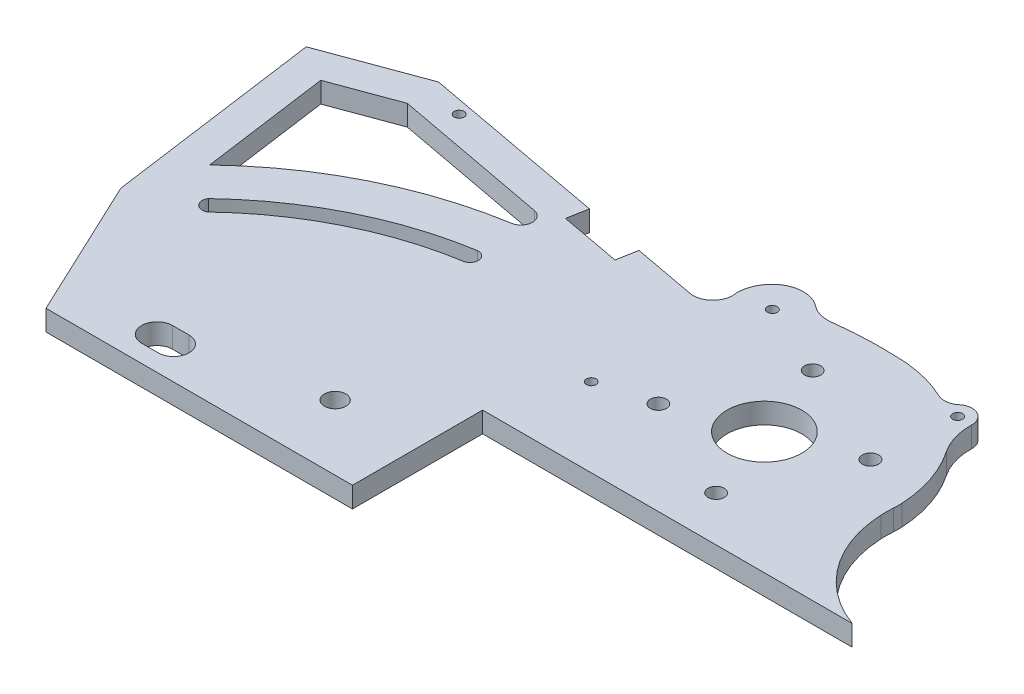
from build123d import *

# Parameters (mm, degrees)
SKETCH1_R           = 1.524
SKETCH1_R_2         = 2.4892
SKETCH1_R_3         = 11.522750336
SKETCH1_R_4         = 3.302
BOSS_EXTRUDE1_DEPTH = 6.35
CHAMFER1_SIZE       = 1.905
SKETCH2_R           = 1.1303
CUT_EXTRUDE1_DEPTH  = 12.7


with BuildPart() as part:
    # Sketch1 → Boss-Extrude1 (new body)
    with BuildSketch(Plane(origin=(0, 0, 0), x_dir=(1, 0, 0), z_dir=(0, 1, 0))):
        with BuildLine():
            Line((-48.989983611, 25.571283439), (-67.720507172, 29.04547214))
            Line((-67.720507172, 29.04547214), (-68.878570072, 22.801964286))
            Line((-68.878570072, 22.801964286), (-87.609093633, 26.276152988))
            Line((-87.609093633, 26.276152988), (-86.451030733, 32.519660841))
            Line((-86.451030733, 32.519660841), (-105.181554294, 35.993849543))
            Line((-105.181554294, 35.993849543), (-123.386535507, 39.370559213))
            Line((-123.386535507, 39.370559213), (-143.61245558, 43.122118146))
            Line((-143.61245558, 43.122118146), (-173.397808446, 32.126880331))
            Line((-173.397808446, 32.126880331), (-164.230158466, -34.209448348))
            Line((-164.230158466, -34.209448348), (-143.692879271, -77.813892282))
            Line((-143.692879271, -77.813892282), (-76.563330949, -77.813892282))
            Line((-76.563330949, -77.813892282), (-49.204879271, -77.813892282))
            Line((-49.204879271, -77.813892282), (-49.204879271, -37.681892282))
            Line((-49.204879271, -37.681892282), (45.277962712, -37.681892282))
            Line((45.277962712, -37.681892282), (64.72671994, -37.681892282))
            ThreePointArc((64.72671994, -37.681892282), (47.456106683, -24.721818432), (40.256527969, -4.364911427))
            ThreePointArc((40.256527969, -4.364911427), (40.224315343, -2.464216219), (40.304028245, -0.564920092))
            ThreePointArc((40.304028245, -0.564920092), (40.358687129, 0.79375425), (40.328560009, 2.153193811))
            ThreePointArc((40.328560009, 2.153193811), (38.274981353, 12.886225143), (33.41911498, 22.675796566))
            ThreePointArc((33.41911498, 22.675796566), (30.929713329, 27.951337515), (30.171477502, 33.73524029))
            ThreePointArc((30.171477502, 33.73524029), (27.651370411, 37.853265988), (22.862043617, 37.243820127))
            ThreePointArc((22.862043617, 37.243820127), (20.166682607, 36.055874133), (17.256896531, 36.513401897))
            ThreePointArc((17.256896531, 36.513401897), (8.843040964, 39.405959226), (0, 40.386))
            ThreePointArc((0, 40.386), (-9.489488111, 40.375548652), (-18.94466273, 39.569219451))
            ThreePointArc((-18.94466273, 39.569219451), (-22.43398811, 39.812343861), (-25.563809609, 41.373983535))
            ThreePointArc((-25.563809609, 41.373983535), (-32.045487778, 43.349075748), (-38.20024979, 40.514989348))
            ThreePointArc((-38.20024979, 40.514989348), (-40.550934903, 36.930082806), (-41.360215512, 32.720291801))
            ThreePointArc((-41.360215512, 32.720291801), (-43.17208429, 27.008072674), (-48.989983611, 25.571283439))
        make_face()
        with Locations(Location((-131.808500509, 37.703534036, 0), (0, 0, 270))):
            Circle(SKETCH1_R, mode=Mode.SUBTRACT)
        with Locations(Location((-31.399492492, 33.846007028, 0), (0, 0, 270))):
            Circle(SKETCH1_R, mode=Mode.SUBTRACT)
        with Locations(Location((-23.788932991, -8.902059713, 0), (0, 0, 270))):
            Circle(SKETCH1_R_2, mode=Mode.SUBTRACT)
        with Locations(Location((8.902059713, -23.788932991, 0), (0, 0, 270))):
            Circle(SKETCH1_R_2, mode=Mode.SUBTRACT)
        with Locations(Location((-8.902059713, 23.788932991, 0), (0, 0, 270))):
            Circle(SKETCH1_R_2, mode=Mode.SUBTRACT)
        with Locations(Location((23.788932991, 8.902059713, 0), (0, 0, 270))):
            Circle(SKETCH1_R_2, mode=Mode.SUBTRACT)
        with Locations(Location((0, 0, 0), (0, 0, 270))):
            Circle(SKETCH1_R_3, mode=Mode.SUBTRACT)
        with Locations(Location((-74.604879271, -57.747892282, 0), (0, 0, 270))):
            Circle(SKETCH1_R_4, mode=Mode.SUBTRACT)
        with Locations(Location((-40.020695033, -13.367428306, 0), (0, 0, 270))):
            Circle(SKETCH1_R, mode=Mode.SUBTRACT)
        with Locations(Location((25.727857837, 33.846007028, 0), (0, 0, 270))):
            Circle(SKETCH1_R, mode=Mode.SUBTRACT)
        with BuildLine():
            Line((-142.716614997, 32.622661546), (-162.215024972, 25.424839998))
            Line((-162.215024972, 25.424839998), (-156.726187504, -14.291916991))
            ThreePointArc((-156.726187504, -14.291916991), (-128.01028366, 5.891204618), (-94.602827713, 16.657049623))
            ThreePointArc((-94.602827713, 16.657049623), (-91.648290045, 20.089389422), (-94.519859105, 23.59143746))
            Line((-94.519859105, 23.59143746), (-142.716614997, 32.622661546))
        make_face(mode=Mode.SUBTRACT)
        with BuildLine():
            Line((-114.508797405, -72.415483536), (-119.588797405, -72.415483536))
            ThreePointArc((-119.588797405, -72.415483536), (-124.351297405, -67.652983536), (-119.588797405, -62.890483536))
            Line((-119.588797405, -62.890483536), (-114.508797405, -62.890483536))
            ThreePointArc((-114.508797405, -62.890483536), (-109.746297405, -67.652983536), (-114.508797405, -72.415483536))
        make_face(mode=Mode.SUBTRACT)
        with BuildLine():
            ThreePointArc((-147.948535824, -23.470306336), (-122.347176599, -5.47625853), (-92.563113904, 4.121916294))
            ThreePointArc((-92.563113904, 4.121916294), (-89.845720269, 1.990682905), (-91.74722838, -0.892137038))
            ThreePointArc((-91.74722838, -0.892137038), (-120.081933775, -10.023243789), (-144.437475152, -27.141662075))
            ThreePointArc((-144.437475152, -27.141662075), (-147.689154448, -26.736809805), (-147.948535824, -23.470306336))
        make_face(mode=Mode.SUBTRACT)
    extrude(amount=BOSS_EXTRUDE1_DEPTH)

    # Chamfer1
    # the kernel refuses this chamfer: 1.905 mm, written as the material it takes off along each edge
    with BuildSketch(Plane(origin=(-131.808500509, 0, -37.703534036), x_dir=(0, 0, 1), z_dir=(-1, 0, 0))) as chamfer1_piece_1:
        Polygon((1.524, CHAMFER1_SIZE), (1.524 + CHAMFER1_SIZE, 0), (1.524, 0), align=None)
    revolve(axis=Axis((-131.808500509, 0, -37.703534036), (0, 1, 0)), mode=Mode.SUBTRACT)
    with BuildSketch(Plane(origin=(-40.020695033, 0, 13.367428306), x_dir=(0, 0, 1), z_dir=(-1, 0, 0))) as chamfer1_piece_2:
        Polygon((1.524, CHAMFER1_SIZE), (1.524 + CHAMFER1_SIZE, 0), (1.524, 0), align=None)
    revolve(axis=Axis((-40.020695033, 0, 13.367428306), (0, 1, 0)), mode=Mode.SUBTRACT)
    with BuildSketch(Plane(origin=(25.727857837, 0, -33.846007028), x_dir=(0, 0, 1), z_dir=(-1, 0, 0))) as chamfer1_piece_3:
        Polygon((1.524, CHAMFER1_SIZE), (1.524 + CHAMFER1_SIZE, 0), (1.524, 0), align=None)
    revolve(axis=Axis((25.727857837, 0, -33.846007028), (0, 1, 0)), mode=Mode.SUBTRACT)
    with BuildSketch(Plane(origin=(-31.399492492, 0, -33.846007028), x_dir=(0, 0, 1), z_dir=(-1, 0, 0))) as chamfer1_piece_4:
        Polygon((1.524, CHAMFER1_SIZE), (1.524 + CHAMFER1_SIZE, 0), (1.524, 0), align=None)
    revolve(axis=Axis((-31.399492492, 0, -33.846007028), (0, 1, 0)), mode=Mode.SUBTRACT)

    # Sketch2 → Cut-Extrude1 (cut)
    with BuildSketch(Plane(origin=(1.797830768, 0, -9.692712298), x_dir=(-0.9832295832535866, 0, -0.18237211029918626), z_dir=(0.18237211029918626, 0, -0.9832295832535866))):
        with Locations((81.406890093, 3.175)):
            Circle(SKETCH2_R)
    extrude(amount=-CUT_EXTRUDE1_DEPTH, mode=Mode.SUBTRACT)


solid = part.part
